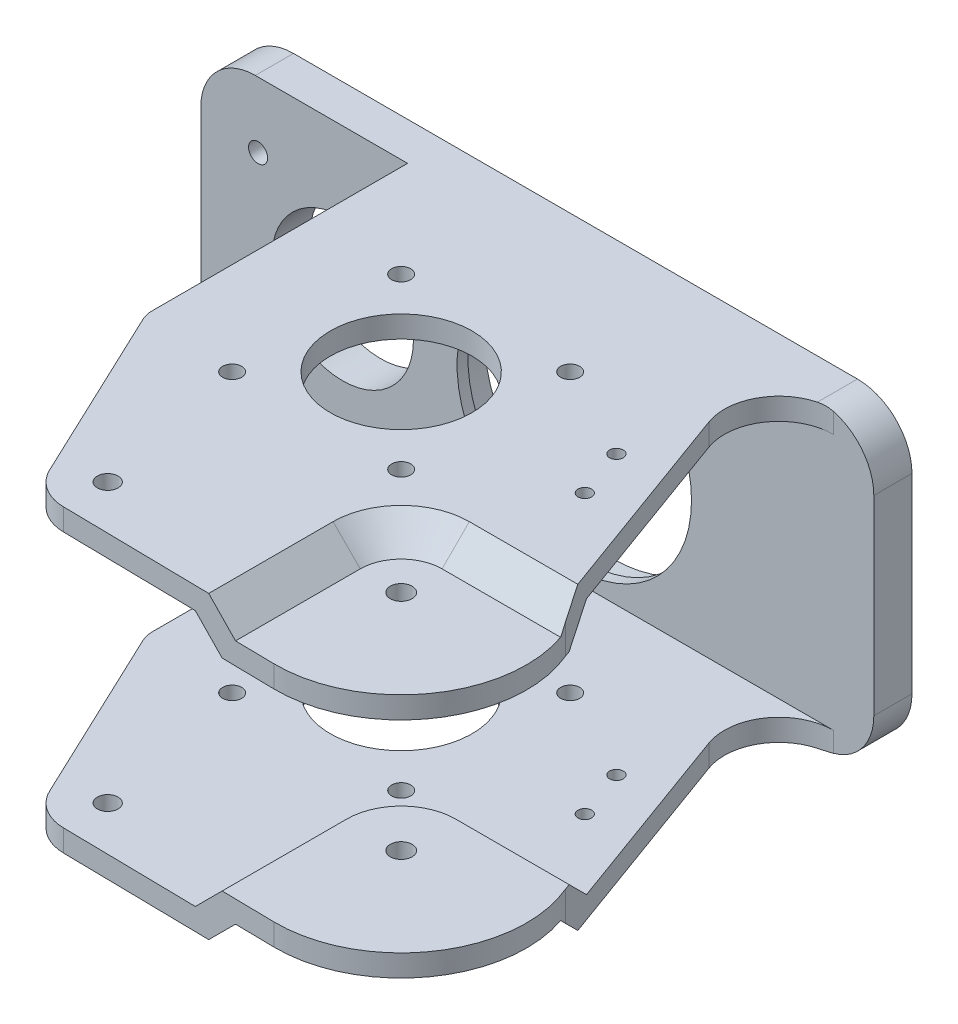
from build123d import *

# Parameters (mm, degrees)
SKETCH_2_R                 = 23.499999999999854
SKETCH_2_R_2               = 12.9999999999999
SKETCH_2_R_3               = 1.7499999999999183
EXTRUDE_1_DEPTH            = 7
SKETCH_5_R                 = 1.2499999999997513
SKETCH_5_R_2               = 1.9999999999997797
SKETCH_5_R_3               = 12.9999999999999
SKETCH_5_R_4               = 1.7500000000003624
SKETCH_5_R_5               = 1.9000000000000128
EXTRUDE_3_DEPTH            = 4
EXTRUDE_START              = -2
SKETCH_6_R                 = 23.499999999999854
SKETCH_6_R_2               = 21.49999999999985
EXTRUDE_4_DEPTH            = 2
FILLET_1_R                 = 10
SKETCH_7_R                 = 3.2500000000000013
SKETCH_7_R_2               = 3.2500000000000004
SKETCH_7_R_3               = 3.250000000000001
CUT_EXTRUDE_4_DEPTH        = 4
SKETCH_18_R                = 1.999999999999777
EXTRUDE_7_DEPTH            = 5
CUT_EXTRUDE_5_DEPTH        = 5
CHAMFER_8_SIZE             = 5
CHAMFER_8_OF_MIRROR_2_SIZE = 5


with BuildPart() as part:
    # 草图2 → 凸台-拉伸1 (new body)
    with BuildSketch(Plane.XY):
        Polygon((-68.50000000000378, -27.499999999999968), (54.94017961354203, -27.499999999999968), (54.94017961354159, 27.4999999999998), (-68.5000000000029, 27.499999999999968), align=None)
        Circle(SKETCH_2_R, mode=Mode.SUBTRACT)
        with Locations((-42.50000000000354, -1.22125e-12)):
            Circle(SKETCH_2_R_2, mode=Mode.SUBTRACT)
        with Locations((-27.000000000003688, 15.499999999998737)):
            Circle(SKETCH_2_R_3, mode=Mode.SUBTRACT)
        with Locations((-27.000000000005464, -15.500000000002178)):
            Circle(SKETCH_2_R_3, mode=Mode.SUBTRACT)
        with Locations((-58.00000000000427, -15.500000000002068)):
            Circle(SKETCH_2_R_3, mode=Mode.SUBTRACT)
        with Locations((-58.00000000000294, 15.499999999998737)):
            Circle(SKETCH_2_R_3, mode=Mode.SUBTRACT)
    extrude(amount=EXTRUDE_1_DEPTH)

    # 草图5 → 凸台-拉伸3 (add)
    with BuildSketch(Plane(origin=(3.71e-14, 27.499999999999876, 0), x_dir=(1, -1.35e-15, 0), z_dir=(1.35e-15, 1, 0))):
        with BuildLine():
            Line((-30.57625495627559, -6.9999999999999964), (47.52563316823275, -6.999999999999941))
            ThreePointArc((47.52563316823275, -6.999999999999941), (39.334112738152676, -11.264235618194132), (38.128706945095715, -20.420201391282454))
            Line((38.128706945095715, -20.420201391282454), (53.20718018719004, -61.84796671962179))
            ThreePointArc((53.20718018719004, -61.84796671962179), (51.05071212212322, -83.63735224169075), (31.628764590502435, -93.74752682099374))
            Line((31.628764590502435, -93.74752682099374), (-7.596215432832855, -93.11432687715183))
            ThreePointArc((-7.596215432832855, -93.11432687715183), (-11.801401356788567, -91.83948575225449), (-14.698924987474284, -88.53597771406503))
            Line((-14.698924987474284, -88.53597771406503), (-30.096151777816445, -55.98323269965879))
            ThreePointArc((-30.096151777816445, -55.98323269965879), (-30.454752886360815, -54.940915116534505), (-30.576254956274703, -53.84535227208149))
            Line((-30.576254956274703, -53.84535227208149), (-30.57625495627559, -6.9999999999999964))
        make_face()
        with Locations(Location((34.72674141312202, -34.00000000000005, 0), (0, 0, 90))):
            Circle(SKETCH_5_R, mode=Mode.SUBTRACT)
        with Locations(Location((38.04433676266059, -43.11501843644486, 0), (0, 0, 90))):
            Circle(SKETCH_5_R, mode=Mode.SUBTRACT)
        with Locations(Location((32.00000000000001, -70.75052301026328, 0), (0, 0, 90))):
            Circle(SKETCH_5_R_2, mode=Mode.SUBTRACT)
        with Locations(Location((1.9479617995710048, -40.698484809835, 0), (0, 0, 90))):
            Circle(SKETCH_5_R_3, mode=Mode.SUBTRACT)
        with Locations(Location((-13.552038200428397, -56.19848480983506, 0), (0, 0, 90))):
            Circle(SKETCH_5_R_4, mode=Mode.SUBTRACT)
        with Locations(Location((17.447961799570404, -56.198484809835, 0), (0, 0, 90))):
            Circle(SKETCH_5_R_4, mode=Mode.SUBTRACT)
        with Locations(Location((17.447961799569516, -25.198484809834156, 0), (0, 0, 90))):
            Circle(SKETCH_5_R_4, mode=Mode.SUBTRACT)
        with Locations(Location((-13.552038200430173, -25.19848480983421, 0), (0, 0, 90))):
            Circle(SKETCH_5_R_4, mode=Mode.SUBTRACT)
        with Locations(Location((-7.467090073007844, -85.11536902994133, 0), (0, 0, 90))):
            Circle(SKETCH_5_R_5, mode=Mode.SUBTRACT)
    extrude_3 = extrude(amount=-EXTRUDE_3_DEPTH)

    # 草图6 → 凸台-拉伸4 (add)
    with BuildSketch(Plane.XY.offset(7).offset(EXTRUDE_START)):
        Circle(SKETCH_6_R)
        Circle(SKETCH_6_R_2, mode=Mode.SUBTRACT)
    extrude(amount=EXTRUDE_4_DEPTH)

    # 镜向1: 凸台-拉伸3 across plane
    add(extrude_3.mirror(Plane.ZX))

    # 圆角1
    fillet_1_edges = [part.edges().sort_by_distance(p)[0] for p in [
        (-68.5000000000029, 27.499999999999968, 3.5),
        (54.94017961354159, 27.4999999999998, 3.5),
        (54.94017961354203, -27.499999999999968, 3.5),
        (-68.50000000000378, -27.499999999999968, 3.5),
    ]]
    fillet(fillet_1_edges, radius=FILLET_1_R)

    # 草图7 → 切除-拉伸4 (cut)
    with BuildSketch(Plane.XY):
        with Locations((-58.00000000000294, 15.499999999998737)):
            Circle(SKETCH_7_R)
        with Locations((-27.000000000003688, 15.499999999998737)):
            Circle(SKETCH_7_R_2)
        with Locations((-27.000000000005464, -15.500000000002178)):
            Circle(SKETCH_7_R_2)
        with Locations((-58.00000000000427, -15.500000000002068)):
            Circle(SKETCH_7_R_3)
    extrude(amount=CUT_EXTRUDE_4_DEPTH, mode=Mode.SUBTRACT)

    # 草图18 → 凸台-拉伸7 (add)
    with BuildSketch(Plane(origin=(3.17e-14, -23.499999999999826, -1.641e-13), x_dir=(1, 1.35e-15, 0), z_dir=(-1.35e-15, 1, 6.98e-15))):
        with BuildLine():
            Line((32.00000000000008, -55.750523010263095), (50.98789220271744, -55.750523010263095))
            Line((50.98789220271744, -55.750523010263095), (53.20718018719011, -61.847966719621596))
            ThreePointArc((53.20718018719011, -61.847966719621596), (51.05071212212356, -83.63735224169073), (31.62876459050252, -93.74752682099322))
            Line((31.62876459050252, -93.74752682099322), (17.000000000000078, -93.51137799665558))
            Line((17.000000000000078, -93.51137799665558), (17.000000000000078, -70.7505230102631))
            ThreePointArc((17.000000000000078, -70.7505230102631), (21.393398282201865, -60.14392129246488), (32.00000000000008, -55.750523010263095))
        make_face()
        with Locations(Location((32.00000000000008, -70.7505230102631, 0), (0, 0, 90))):
            Circle(SKETCH_18_R, mode=Mode.SUBTRACT)
    extrude_7 = extrude(amount=EXTRUDE_7_DEPTH)

    # 草图9 → 切除-拉伸5 (cut)
    with BuildSketch(Plane.XZ.offset(27.499999999999968)):
        with BuildLine():
            Line((19.50000000000005, 70.75052301026328), (19.500000000000046, 93.55173492886229))
            Line((19.500000000000046, 93.55173492886229), (31.628764590502485, 93.74752682099341))
            ThreePointArc((31.628764590502485, 93.74752682099341), (51.05071212212326, 83.63735224169075), (53.207180187190076, 61.84796671962179))
            Line((53.207180187190076, 61.84796671962179), (51.89781777573519, 58.25052301026329))
            Line((51.89781777573519, 58.25052301026329), (32.00000000000004, 58.25052301026329))
            ThreePointArc((32.00000000000004, 58.25052301026329), (23.161165235168202, 61.91168824543144), (19.50000000000005, 70.75052301026328))
        make_face()
    cut_extrude_5 = extrude(amount=-CUT_EXTRUDE_5_DEPTH, mode=Mode.SUBTRACT)

    # 倒角8
    chamfer_8_edges = [part.edges().sort_by_distance(p)[0] for p in [
        (41.94890888786762, -22.499999999999968, 58.25052301026329),
        (23.161165235168205, -22.499999999999968, 61.91168824543144),
        (19.50000000000005, -22.499999999999968, 82.15112896956279),
        (41.49394610135879, -18.50000000000016, 55.75052301026297),
        (21.39339828220189, -18.500000000000217, 60.14392129246475),
        (17.000000000000103, -18.500000000000377, 82.1309505034592),
    ]]
    chamfer(chamfer_8_edges, length=CHAMFER_8_SIZE - 0.0001)  # a hair under: the kernel refuses the full size

    # 镜向2: 凸台-拉伸7, 切除-拉伸5 across plane
    add(extrude_7.mirror(Plane.ZX))
    add(cut_extrude_5.mirror(Plane.ZX), mode=Mode.SUBTRACT)

    # 倒角8 of 镜向2
    chamfer_8_of_mirror_2_edges = [part.edges().sort_by_distance(p)[0] for p in [
        (41.94890888786762, 22.499999999999968, 58.25052301026329),
        (23.161165235168205, 22.499999999999968, 61.91168824543144),
        (19.50000000000005, 22.499999999999968, 82.15112896956279),
        (41.49394610135879, 18.500000000000153, 55.75052301026297),
        (21.39339828220189, 18.500000000000217, 60.14392129246475),
        (17.000000000000103, 18.50000000000038, 82.1309505034592),
    ]]
    chamfer(chamfer_8_of_mirror_2_edges, length=CHAMFER_8_OF_MIRROR_2_SIZE - 0.0001)  # a hair under: the kernel refuses the full size


solid = part.part
